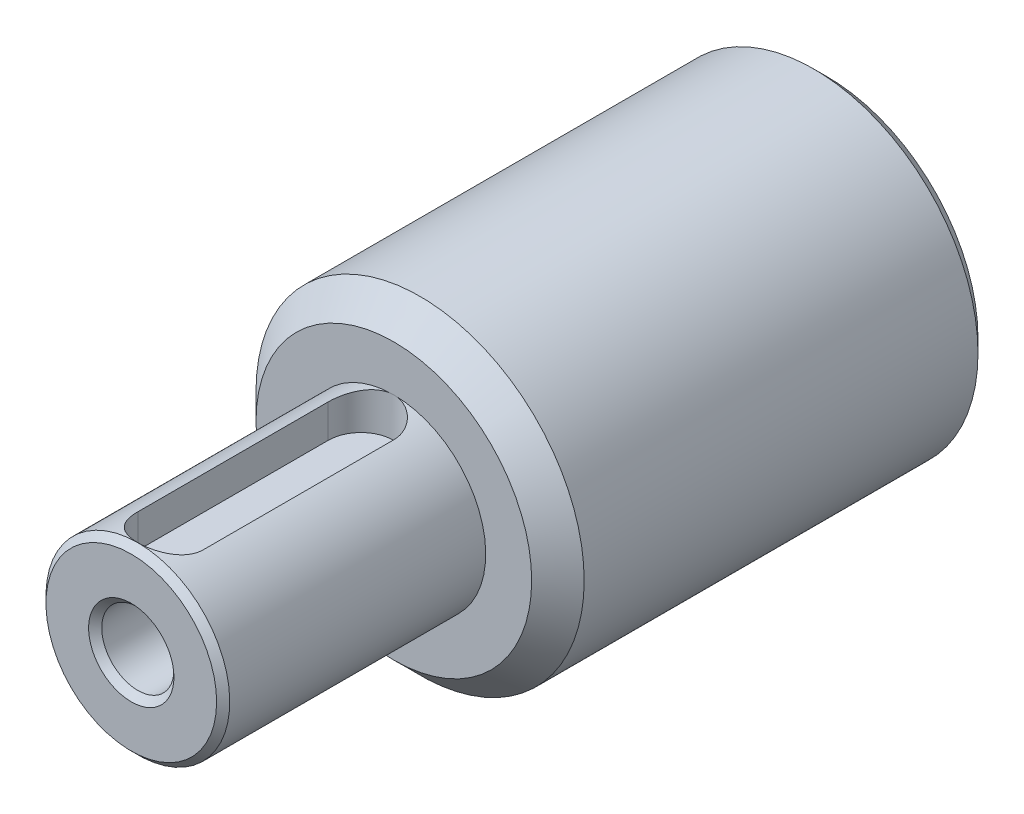
from build123d import *

# Parameters (mm, degrees)
SKETCH_1_R          = 12.5
EXTRUDE_1_DEPTH     = 33
SKETCH_4_R          = 7
EXTRUDE_2_DEPTH     = 3
SKETCH_7_R          = 7
EXTRUDE_3_DEPTH     = 20
CHAMFER_1_SIZE      = 2
CUT_EXTRUDE_4_DEPTH = 3
CHAMFER_2_SIZE      = 0.5
CHAMFER_3_SIZE      = 1
SKETCH_9_R          = 7
CUT_EXTRUDE_5_DEPTH = 28
SKETCH_10_W         = 5
SKETCH_10_H         = 4.667686035
CUT_EXTRUDE_6_DEPTH = 26
CHAMFER_4_SIZE      = 0.5
SKETCH_11_R         = 2.75
CUT_EXTRUDE_7_DEPTH = 50
CHAMFER_5_SIZE      = 0.5
FILLET_1_R          = 1


with BuildPart() as part:
    # 草图1 → 拉伸1 (new body)
    with BuildSketch(Plane.XY):
        Circle(SKETCH_1_R)
    extrude(amount=EXTRUDE_1_DEPTH)

    # 草图4 → 拉伸2 (add)
    with BuildSketch(Plane.XY.offset(33)):
        Circle(SKETCH_4_R)
    extrude(amount=-EXTRUDE_2_DEPTH)

    # 草图7 → 拉伸3 (add)
    with BuildSketch(Plane.XY.offset(33)):
        Circle(SKETCH_7_R)
    extrude(amount=EXTRUDE_3_DEPTH)

    # 倒角1
    chamfer_1_edges = [part.edges().sort_by_distance(p)[0] for p in [
        (-12.5, 0, 33),
    ]]
    chamfer(chamfer_1_edges, length=CHAMFER_1_SIZE)

    # 草图8 → 切除-拉伸4 (cut)
    with BuildSketch(Plane(origin=(0, 7, 0), x_dir=(-1, 0, 0), z_dir=(0, 1, 0))):
        with BuildLine():
            Line((-2.5, 50), (-2.5, 35.5))
            ThreePointArc((-2.5, 35.5), (0, 33), (2.5, 35.5))
            Line((2.5, 35.5), (2.5, 50))
            ThreePointArc((2.5, 50), (0, 52.5), (-2.5, 50))
        make_face()
    extrude(amount=-CUT_EXTRUDE_4_DEPTH, mode=Mode.SUBTRACT)

    # 倒角2
    chamfer_2_edges = [part.edges().sort_by_distance(p)[0] for p in [
        (-7, 0, 53),
    ]]
    chamfer(chamfer_2_edges, length=CHAMFER_2_SIZE - 0.0001)  # a hair under: the kernel refuses the full size

    # 倒角3
    chamfer_3_edges = [part.edges().sort_by_distance(p)[0] for p in [
        (-12.5, 0, 0),
    ]]
    chamfer(chamfer_3_edges, length=CHAMFER_3_SIZE)

    # 草图9 → 切除-拉伸5 (cut)
    with BuildSketch(Plane(origin=(0, 0, 0), x_dir=(-1, 0, 0), z_dir=(0, 0, -1))):
        Circle(SKETCH_9_R)
    extrude(amount=-CUT_EXTRUDE_5_DEPTH, mode=Mode.SUBTRACT)

    # 草图10 → 切除-拉伸6 (cut)
    with BuildSketch(Plane(origin=(0, 0, 0), x_dir=(-1, 0, 0), z_dir=(0, 0, -1))):
        with Locations((0, 6.666156983)):
            Rectangle(SKETCH_10_W, SKETCH_10_H)
    extrude(amount=-CUT_EXTRUDE_6_DEPTH, mode=Mode.SUBTRACT)

    # 倒角4
    chamfer_4_edges = [part.edges().sort_by_distance(p)[0] for p in [
        (3.968626967, -5.766281297, 0),
    ]]
    chamfer(chamfer_4_edges, length=CHAMFER_4_SIZE)

    # 草图11 → 切除-拉伸7 (cut)
    with BuildSketch(Plane.XY.offset(53)):
        Circle(SKETCH_11_R)
    extrude(amount=-CUT_EXTRUDE_7_DEPTH, mode=Mode.SUBTRACT)

    # 倒角5
    chamfer_5_edges = [part.edges().sort_by_distance(p)[0] for p in [
        (-2.75, 0, 53),
    ]]
    chamfer(chamfer_5_edges, length=CHAMFER_5_SIZE)

    # 圆角1
    fillet_1_edges = [part.edges().sort_by_distance(p)[0] for p in [
        (7, 0, 28),
    ]]
    fillet(fillet_1_edges, radius=FILLET_1_R)


solid = part.part
